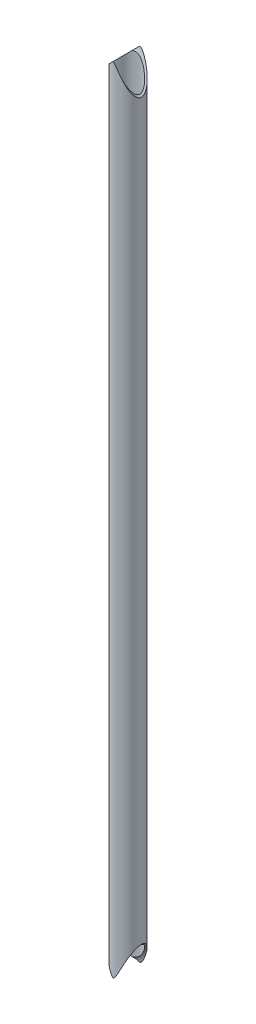
from build123d import *

# Parameters (mm, degrees)
SKETCH1_R           = 12.7
SKETCH1_R_2         = 11.05
BOSS_EXTRUDE1_DEPTH = 375
SKETCH2_R           = 13
CUT_EXTRUDE1_DEPTH  = 751.21502251
CUT_EXTRUDE2_START  = -12.606982135
CUT_EXTRUDE2_DEPTH  = 25.21396427


# Read off the part's stored shape, not the designer's step: Cut-Extrude2
with BuildPart() as part:
    # Sketch1 → Boss-Extrude1 (new, symmetric)
    with BuildSketch(Plane(origin=(0, 0, 0), x_dir=(1, 0, 0), z_dir=(0, 1, 0))):
        with Locations(Location((0, 0, 0), (0, 0, 270))):
            Circle(SKETCH1_R)
        with Locations(Location((0, 0, 0), (0, 0, 270))):
            Circle(SKETCH1_R_2, mode=Mode.SUBTRACT)
    extrude(amount=BOSS_EXTRUDE1_DEPTH, both=True)

    # Sketch2 → Cut-Extrude1 (cut, symmetric)
    with BuildSketch(Plane(origin=(0, -375, 0), x_dir=(0, 0, -1), z_dir=(0.707545129365096, 0.7066681610994865, 0))):
        Circle(SKETCH2_R)
    cut_extrude1 = extrude(amount=CUT_EXTRUDE1_DEPTH, both=True, mode=Mode.SUBTRACT)

    # Mirror1: Cut-Extrude1 across plane
    add(cut_extrude1.mirror(Plane.ZX), mode=Mode.SUBTRACT)

    # Cut-Extrude2 outline → Cut-Extrude2 (cut)
    with BuildSketch(Plane.XY.offset(CUT_EXTRUDE2_START)):
        Polygon((0, -373.584908653), (-1.534275545, -372.048729087), (-12.7, -360.869148077), (-14, -359.56753479), (-14, -374), (0, -374), align=None)
    cut_extrude2 = extrude(amount=CUT_EXTRUDE2_DEPTH, mode=Mode.SUBTRACT)

    # Mirror2: Cut-Extrude2 across plane
    add(cut_extrude2.mirror(Plane.ZX), mode=Mode.SUBTRACT)


solid = part.part
